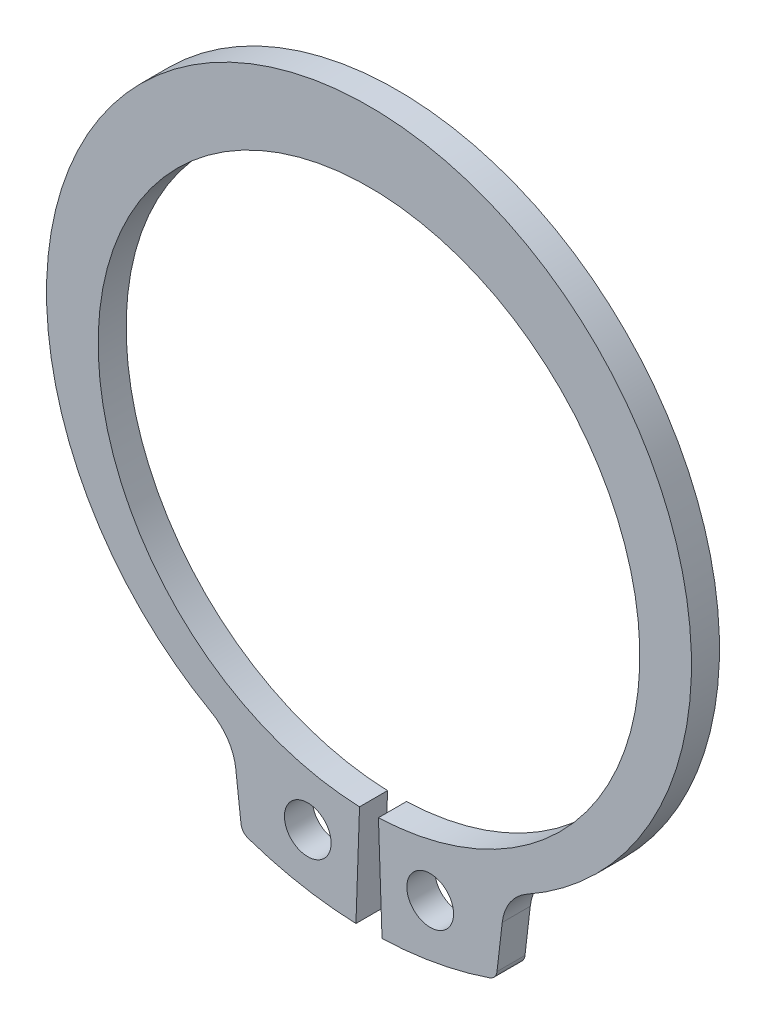
from build123d import *

# Parameters (mm, degrees)
SKETCH1_R            = 1
BOSS_EXTRUDE1_DEPTH  = 1.2
FILLET1_R            = 2.07
FILLET4_R            = 0.47
FILLET1_OF_MIRROR1_R = 2.07
FILLET4_OF_MIRROR1_R = 0.47


with BuildPart() as part:
    # Sketch1 → Boss-Extrude1 (new body)
    with BuildSketch(Plane.XY):
        with BuildLine():
            Line((0, 16.208466633), (0, 13.208466633))
            ThreePointArc((0, 13.208466633), (-11.598233264, 1.810914547), (-0.404834162, -9.984466961))
            Line((-0.404834162, -9.984466961), (-0.558732312, -14.391533367))
            ThreePointArc((-0.558732312, -14.391533367), (-3.040269481, -14.109960238), (-5.447822247, -13.44588206))
            Line((-5.447822247, -13.44588206), (-5.834491431, -10.120502194))
            ThreePointArc((-5.834491431, -10.120502194), (-13.48384116, 5.385536534), (0, 16.208466633))
        make_face()
        with Locations((-2.621561059, -11.945205518)):
            Circle(SKETCH1_R, mode=Mode.SUBTRACT)
    boss_extrude1 = extrude(amount=BOSS_EXTRUDE1_DEPTH)

    # Fillet1
    fillet1_edges = [part.edges().sort_by_distance(p)[0] for p in [
        (-5.834491431, -10.120502194, 0.6),
    ]]
    fillet(fillet1_edges, radius=FILLET1_R)

    # Fillet4
    fillet4_edges = [part.edges().sort_by_distance(p)[0] for p in [
        (-5.447822247, -13.44588206, 0.6),
    ]]
    fillet(fillet4_edges, radius=FILLET4_R)

    # Mirror1: Boss-Extrude1 across plane
    add(boss_extrude1.mirror(Plane(origin=(0, 16.208466633, 1.2), x_dir=(0, 0, 1), z_dir=(-1, 0, 0))))

    # Fillet1 of Mirror1
    fillet1_of_mirror1_edges = [part.edges().sort_by_distance(p)[0] for p in [
        (5.834491431, -10.120502194, 0.6),
    ]]
    fillet(fillet1_of_mirror1_edges, radius=FILLET1_OF_MIRROR1_R)

    # Fillet4 of Mirror1
    fillet4_of_mirror1_edges = [part.edges().sort_by_distance(p)[0] for p in [
        (5.447822247, -13.44588206, 0.6),
    ]]
    fillet(fillet4_of_mirror1_edges, radius=FILLET4_OF_MIRROR1_R)


solid = part.part
